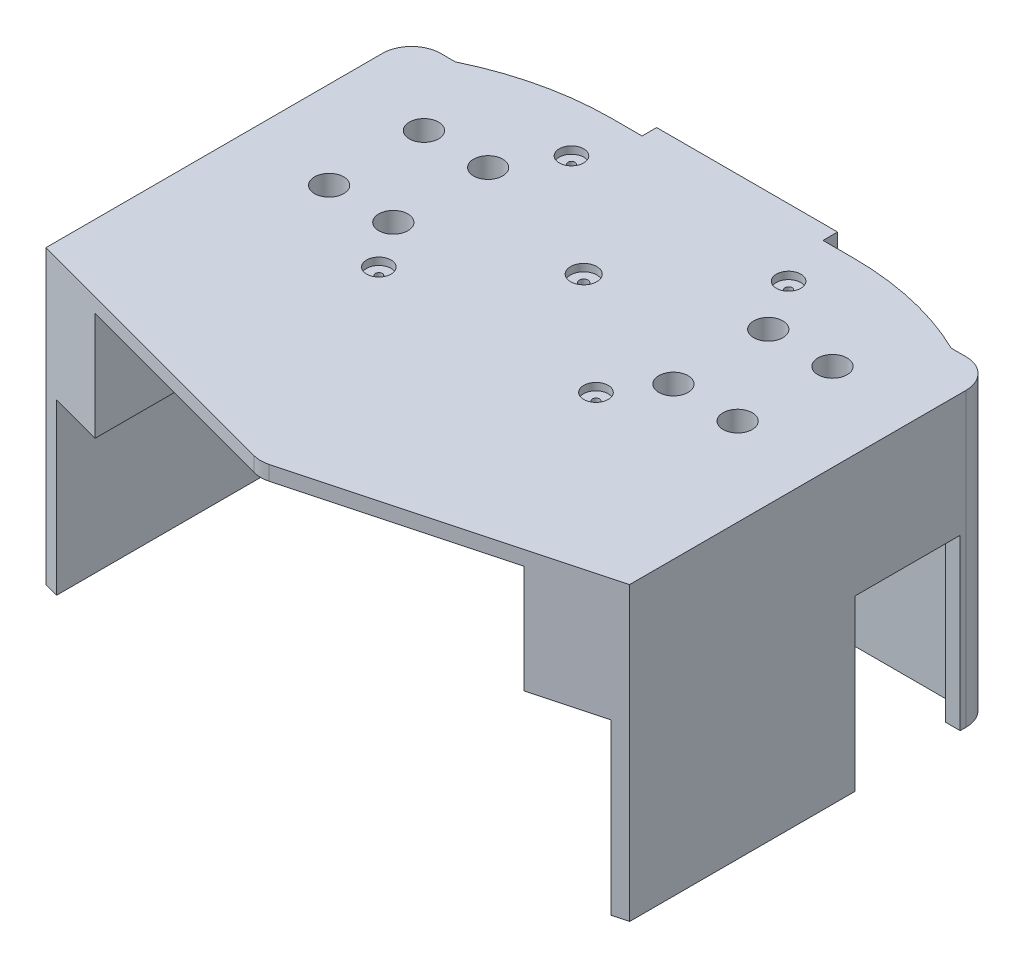
from build123d import *

# Parameters (mm, degrees)
BOSS_EXTRUDE1_DEPTH      = 50
BOSS_EXTRUDE1_DEPTH_BACK = 50
SKETCH1_W                = 200
SKETCH1_H                = 152.061
SHELL1_T                 = -5
SKETCH3_W                = 190
SKETCH3_H                = 142.061
BOSS_EXTRUDE2_DEPTH      = 37
CUT_EXTRUDE1_REACH       = 221.729
SKETCH2_W                = 36
SKETCH2_H                = 58
SKETCH4_W                = 36
SKETCH4_H                = 46.5
SKETCH4_R                = 2
CUT_EXTRUDE2_DEPTH       = 2
SKETCH4_3_R              = 2
CUT_EXTRUDE3_DEPTH       = 139.364146115
SKETCH5_W                = 169.952904784
SKETCH5_H                = 5
CUT_EXTRUDE4_DEPTH       = 63
CUT_EXTRUDE5_START       = -37
CUT_EXTRUDE5_DEPTH       = 37
SKETCH9_R                = 1.2
SKETCH9_R_2              = 1.5
CUT_EXTRUDE6_DEPTH       = 10
CUT_EXTRUDE7_DEPTH       = 102
FILLET1_R                = 10
SKETCH11_W               = 62
SKETCH11_H               = 5
BOSS_EXTRUDE3_DEPTH      = 100
SKETCH12_W               = 57
SKETCH12_H               = 3
SKETCH12_W_2             = 43
SKETCH12_H_2             = 2
CUT_EXTRUDE8_DEPTH       = 91
SKETCH13_W               = 57
SKETCH13_H               = 3
CUT_EXTRUDE9_DEPTH       = 7
FILLET2_R                = 10
FILLET3_R                = 100
SKETCH15_R               = 5
CUT_EXTRUDE10_DEPTH      = 28
SKETCH17_R               = 4.2
SKETCH17_R_2             = 4.5
CUT_EXTRUDE11_DEPTH      = 2.5


# Read off the part's stored shape, not the designer's step: Cut-Extrude5
with BuildPart() as part:
    # Sketch1 → Boss-Extrude1 (new, two sides: drawn at the far end of the back side and taken through both)
    with BuildSketch(Plane(origin=(0, 0, 0), x_dir=(1, 0, 0), z_dir=(0, 1, 0)).offset(-BOSS_EXTRUDE1_DEPTH_BACK)):
        Rectangle(SKETCH1_W, SKETCH1_H)
    extrude(amount=BOSS_EXTRUDE1_DEPTH + BOSS_EXTRUDE1_DEPTH_BACK)

    # Shell1
    shell1_openings = [part.faces().sort_by_distance(p)[0] for p in [
        (0, -50, 0),
    ]]
    offset(amount=SHELL1_T, openings=shell1_openings, kind=Kind.INTERSECTION)

    # Sketch3 → Boss-Extrude2 (add)
    with BuildSketch(Plane.XZ.offset(-45)):
        Rectangle(SKETCH3_W, SKETCH3_H)
    extrude(amount=BOSS_EXTRUDE2_DEPTH)

    # Sketch2 → Cut-Extrude1 (cut, up to next)
    with BuildSketch(Plane.ZY.offset(100), mode=Mode.PRIVATE) as cut_extrude1_sk1:
        with Locations((-46.0305, -21)):
            Rectangle(SKETCH2_W, SKETCH2_H)
    cut_extrude1_tool1 = extrude(cut_extrude1_sk1.sketch, amount=-CUT_EXTRUDE1_REACH, mode=Mode.PRIVATE) & part.part
    cut_extrude1 = cut_extrude1_tool1.solids().sort_by_distance((-100, -21, -46.0305))[0]
    add(cut_extrude1, mode=Mode.SUBTRACT)

    # Mirror1: Cut-Extrude1 across plane
    add(cut_extrude1.mirror(Plane(origin=(0, 0, 0), x_dir=(0, 0, 1), z_dir=(1, 0, 0))), mode=Mode.SUBTRACT)

    # Sketch4 → Cut-Extrude2 (cut)
    with BuildSketch(Plane.XZ.offset(-8)):
        with Locations((-59, -34.0305)):
            Rectangle(SKETCH4_W, SKETCH4_H)
        with Locations(Location((-48, -50.2805, 0), (0, 0, 270))):
            Circle(SKETCH4_R, mode=Mode.SUBTRACT)
        with Locations(Location((-70, -50.2805, 0), (0, 0, 270))):
            Circle(SKETCH4_R, mode=Mode.SUBTRACT)
        with Locations(Location((-48, -17.7805, 0), (0, 0, 270))):
            Circle(SKETCH4_R, mode=Mode.SUBTRACT)
        with Locations(Location((-70, -17.7805, 0), (0, 0, 270))):
            Circle(SKETCH4_R, mode=Mode.SUBTRACT)
    cut_extrude2 = extrude(amount=-CUT_EXTRUDE2_DEPTH, mode=Mode.SUBTRACT)

    # Sketch4<3> → Cut-Extrude3 (cut, through all)
    with BuildSketch(Plane.XZ.offset(-8)):
        with BuildLine():
            Line((-70, -19.7805), (-70, -17.7805))
            Line((-70, -17.7805), (-68, -17.7805))
            ThreePointArc((-68, -17.7805), (-71.414213562, -16.366286438), (-70, -19.7805))
        make_face()
        with BuildLine():
            Line((-68, -17.7805), (-70, -17.7805))
            Line((-70, -17.7805), (-70, -19.7805))
            ThreePointArc((-70, -19.7805), (-68.585786438, -19.194713562), (-68, -17.7805))
        make_face()
        with Locations(Location((-48, -17.7805, 0), (0, 0, 270))):
            Circle(SKETCH4_3_R)
        with Locations(Location((-70, -50.2805, 0), (0, 0, 270))):
            Circle(SKETCH4_3_R)
        with Locations(Location((-48, -50.2805, 0), (0, 0, 270))):
            Circle(SKETCH4_3_R)
    cut_extrude3 = extrude(amount=-CUT_EXTRUDE3_DEPTH, mode=Mode.SUBTRACT)

    # Mirror2: Cut-Extrude2, Cut-Extrude3 across plane
    add(cut_extrude2.mirror(Plane(origin=(0, 0, 0), x_dir=(0, 0, 1), z_dir=(1, 0, 0))), mode=Mode.SUBTRACT)
    add(cut_extrude3.mirror(Plane(origin=(0, 0, 0), x_dir=(0, 0, 1), z_dir=(1, 0, 0))), mode=Mode.SUBTRACT)

    # Sketch5 → Cut-Extrude4 (cut)
    with BuildSketch(Plane.XZ.offset(-8)):
        with Locations((10.023547608, 73.5305)):
            Rectangle(SKETCH5_W, SKETCH5_H)
    extrude(amount=CUT_EXTRUDE4_DEPTH, mode=Mode.SUBTRACT)

    # Cut-Extrude5 outline → Cut-Extrude5 (cut)
    with BuildSketch(Plane.XZ.offset(-8).offset(CUT_EXTRUDE5_START)):
        Polygon((-41, -10.7805), (-41, -71.0305), (41, -71.0305), (41, -10.7805), (71.419165144, -10.7805), (71.419165144, 76.0305), (-74.952904784, 76.0305), (-74.952904784, 71.0305), (-77, 71.0305), (-77, -10.7805), align=None)
    extrude(amount=CUT_EXTRUDE5_DEPTH, mode=Mode.SUBTRACT)

    # Sketch9 → Cut-Extrude6 (cut)
    with BuildSketch(Plane.XZ.offset(-45)):
        with Locations(Location((37.2, -68.0305, 0), (0, 0, 270))):
            Circle(SKETCH9_R)
        with Locations(Location((-37.2, -68.0305, 0), (0, 0, 270))):
            Circle(SKETCH9_R)
        with Locations(Location((37.2, -2.0305, 0), (0, 0, 270))):
            Circle(SKETCH9_R)
        with Locations(Location((-37.2, -2.0305, 0), (0, 0, 270))):
            Circle(SKETCH9_R)
        with Locations(Location((0, -35.0305, 0), (0, 0, 270))):
            Circle(SKETCH9_R_2)
    extrude(amount=-CUT_EXTRUDE6_DEPTH, mode=Mode.SUBTRACT)

    # Sketch10 → Cut-Extrude7 (cut)
    with BuildSketch(Plane.XZ.offset(50)):
        Polygon((0, 76.0305), (100, 49.235580757), (100, 76.0305), align=None)
    cut_extrude7 = extrude(amount=-CUT_EXTRUDE7_DEPTH, mode=Mode.SUBTRACT)

    # Mirror3: Cut-Extrude7 across plane
    add(cut_extrude7.mirror(Plane(origin=(0, 0, 0), x_dir=(0, 0, 1), z_dir=(1, 0, 0))), mode=Mode.SUBTRACT)

    # Fillet1
    fillet1_edges = [part.edges().sort_by_distance(p)[0] for p in [
        (0, 47.5, 76.0305),
    ]]
    fillet(fillet1_edges, radius=FILLET1_R)

    # Sketch11 → Boss-Extrude3 (add)
    with BuildSketch(Plane.XZ.offset(50)):
        Polygon((85, -86.0305), (85, -76.0305), (-85, -76.0305), (-85, -86.0305), (-31, -86.0305), (31, -86.0305), align=None)
        with Locations((0, -88.5305)):
            Rectangle(SKETCH11_W, SKETCH11_H)
    extrude(amount=-BOSS_EXTRUDE3_DEPTH)

    # Sketch12 → Cut-Extrude8 (cut)
    with BuildSketch(Plane.XZ.offset(50)):
        with Locations((0, -87.5305)):
            Rectangle(SKETCH12_W, SKETCH12_H)
        with Locations((0, -90.0305)):
            Rectangle(SKETCH12_W_2, SKETCH12_H_2)
    extrude(amount=-CUT_EXTRUDE8_DEPTH, mode=Mode.SUBTRACT)

    # Sketch13 → Cut-Extrude9 (cut)
    with BuildSketch(Plane.XZ.offset(-41)):
        with Locations((0, -87.5305)):
            Rectangle(SKETCH13_W, SKETCH13_H)
    extrude(amount=-CUT_EXTRUDE9_DEPTH, mode=Mode.SUBTRACT)

    # Fillet2
    fillet2_edges = [part.edges().sort_by_distance(p)[0] for p in [
        (-100, 0, -76.0305),
        (100, 0, -76.0305),
    ]]
    fillet(fillet2_edges, radius=FILLET2_R)

    # Fillet3
    # the kernel refuses this fillet: 100 mm, written as the material it takes off along each edge
    with BuildSketch(Plane(origin=(-85, -158.972473589, -86.0305), x_dir=(0, 0, 1), z_dir=(0, 1, 0))) as fillet3_piece_1:
        with BuildLine():
            CenterArc((100, 43.588989435), FILLET3_R, 180, 25.841932763)
            Line((0, 43.588989435), (-2, 43.588989435))
            Line((-2, 43.588989435), (-2, 0))
            Line((-2, 0), (0, -2))
            ThreePointArc((0, -2), (5, -2), (8.2, -0.871779789))
            Line((8.2, -0.871779789), (10, 0))
        make_face()
    extrude(amount=317.944947177, mode=Mode.SUBTRACT)
    with BuildSketch(Plane(origin=(85, -158.972473589, -86.0305), x_dir=(0, 0, 1), z_dir=(0, 1, 0))) as fillet3_piece_2:
        with BuildLine():
            CenterArc((100, -43.588989435), FILLET3_R, 154.158067237, 25.841932763)
            Line((0, -43.588989435), (-2, -43.588989435))
            Line((-2, -43.588989435), (-2, 0))
            Line((-2, 0), (0, 2))
            ThreePointArc((0, 2), (5, 2), (8.2, 0.871779789))
            Line((8.2, 0.871779789), (10, 0))
        make_face()
    extrude(amount=317.944947177, mode=Mode.SUBTRACT)

    # Sketch15 → Cut-Extrude10 (cut)
    with BuildSketch(Plane(origin=(0, 50, 0), x_dir=(1, 0, 0), z_dir=(0, 1, 0))):
        with Locations(Location((70, 17.7805, 0), (0, 0, 270))):
            Circle(SKETCH15_R)
        with Locations(Location((48, 17.7805, 0), (0, 0, 270))):
            Circle(SKETCH15_R)
        with Locations(Location((70, 50.2805, 0), (0, 0, 270))):
            Circle(SKETCH15_R)
        with Locations(Location((-48, 50.2805, 0), (0, 0, 90))):
            Circle(SKETCH15_R)
        with Locations(Location((48, 50.2805, 0), (0, 0, 270))):
            Circle(SKETCH15_R)
        with Locations(Location((-70, 50.2805, 0), (0, 0, 90))):
            Circle(SKETCH15_R)
        with Locations(Location((-48, 17.7805, 0), (0, 0, 90))):
            Circle(SKETCH15_R)
        with Locations(Location((-70, 17.7805, 0), (0, 0, 90))):
            Circle(SKETCH15_R)
    extrude(amount=-CUT_EXTRUDE10_DEPTH, mode=Mode.SUBTRACT)

    # Sketch17 → Cut-Extrude11 (cut)
    with BuildSketch(Plane(origin=(0, 50, 0), x_dir=(1, 0, 0), z_dir=(0, 1, 0))):
        with Locations(Location((-37.2, 2.0305, 0), (0, 0, 270))):
            Circle(SKETCH17_R)
        with Locations(Location((37.2, 68.0305, 0), (0, 0, 270))):
            Circle(SKETCH17_R)
        with Locations(Location((37.2, 2.0305, 0), (0, 0, 270))):
            Circle(SKETCH17_R)
        with Locations(Location((-37.2, 68.0305, 0), (0, 0, 270))):
            Circle(SKETCH17_R)
        with Locations(Location((0, 35.0305, 0), (0, 0, 270))):
            Circle(SKETCH17_R_2)
    extrude(amount=-CUT_EXTRUDE11_DEPTH, mode=Mode.SUBTRACT)


solid = part.part
